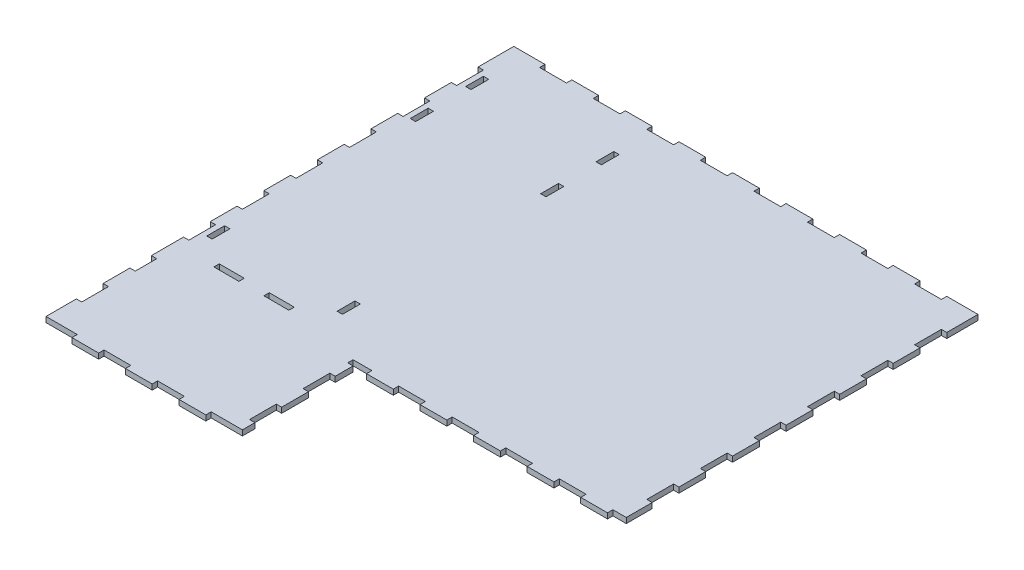
from build123d import *

# Parameters (mm, degrees)
CROQUIS1_W              = 3
CROQUIS1_H              = 9.962316565
CROQUIS1_H_2            = 10
CROQUIS1_W_2            = 14
CROQUIS1_H_3            = 3
SALIENTE_EXTRUIR1_DEPTH = 3


with BuildPart() as part:
    # Croquis1 → Saliente-Extruir1 (new body)
    with BuildSketch(Plane(origin=(0, 0, 0), x_dir=(1, 0, 0), z_dir=(0, 1, 0))):
        Polygon((17.5, 0), (32.5, 0), (32.5, 3), (47.5, 3), (47.5, 0), (62.5, 0), (62.5, 3), (77.5, 3), (77.5, 0), (92.5, 0), (92.5, 3), (110, 3), (110, 10), (107, 10), (107, 25), (110, 25), (110, 40), (107, 40), (107, 55), (110, 55), (110, 65), (107, 65), (107, 68), (117.5, 68), (117.5, 65), (132.5, 65), (132.5, 68), (147.5, 68), (147.5, 65), (162.5, 65), (162.5, 68), (177.5, 68), (177.5, 65), (192.5, 65), (192.5, 68), (207.5, 68), (207.5, 65), (222.5, 65), (222.5, 68), (237.5, 68), (237.5, 65), (252.5, 65), (252.5, 68), (260, 68), (260, 82.5), (257, 82.5), (257, 97.5), (260, 97.5), (260, 112.5), (257, 112.5), (257, 127.5), (260, 127.5), (260, 142.5), (257, 142.5), (257, 157.5), (260, 157.5), (260, 172.5), (257, 172.5), (257, 187.5), (260, 187.5), (260, 202.5), (257, 202.5), (257, 217.5), (260, 217.5), (260, 232.5), (257, 232.5), (257, 247.5), (260, 247.5), (260, 265), (242.5, 265), (242.5, 262), (227.5, 262), (227.5, 265), (212.5, 265), (212.5, 262), (197.5, 262), (197.5, 265), (182.5, 265), (182.5, 262), (167.5, 262), (167.5, 265), (152.5, 265), (152.5, 262), (137.5, 262), (137.5, 265), (122.5, 265), (122.5, 262), (107.5, 262), (107.5, 265), (92.5, 265), (92.5, 262), (77.5, 262), (77.5, 265), (62.5, 265), (62.5, 262), (47.5, 262), (47.5, 265), (32.5, 265), (32.5, 262), (17.5, 262), (17.5, 265), (0, 265), (0, 245), (3, 245), (3, 230), (0, 230), (0, 215), (3, 215), (3, 200), (0, 200), (0, 185), (3, 185), (3, 170), (0, 170), (0, 155), (3, 155), (3, 140), (0, 140), (0, 125), (3, 125), (3, 110), (0, 110), (0, 95), (3, 95), (3, 80), (0, 80), (0, 62), (3, 62), (3, 50), (0, 50), (0, 35), (3, 35), (3, 20), (0, 20), (0, 3), (17.5, 3), align=None)
        with Locations((7.5, 237.018841718)):
            Rectangle(CROQUIS1_W, CROQUIS1_H, mode=Mode.SUBTRACT)
        with Locations((7.5, 206.037683435)):
            Rectangle(CROQUIS1_W, CROQUIS1_H_2, mode=Mode.SUBTRACT)
        with Locations((7.5, 92.037683435)):
            Rectangle(CROQUIS1_W, CROQUIS1_H_2, mode=Mode.SUBTRACT)
        with Locations((30, 75.537683435)):
            Rectangle(CROQUIS1_W_2, CROQUIS1_H_3, mode=Mode.SUBTRACT)
        with Locations((80.5, 206.037683435)):
            Rectangle(CROQUIS1_W, CROQUIS1_H_2, mode=Mode.SUBTRACT)
        with Locations((58, 75.537683435)):
            Rectangle(CROQUIS1_W_2, CROQUIS1_H_3, mode=Mode.SUBTRACT)
        with Locations((80.5, 92.037683435)):
            Rectangle(CROQUIS1_W, CROQUIS1_H_2, mode=Mode.SUBTRACT)
        with Locations((80.5, 237.037683435)):
            Rectangle(CROQUIS1_W, CROQUIS1_H_2, mode=Mode.SUBTRACT)
    extrude(amount=SALIENTE_EXTRUIR1_DEPTH)


solid = part.part
